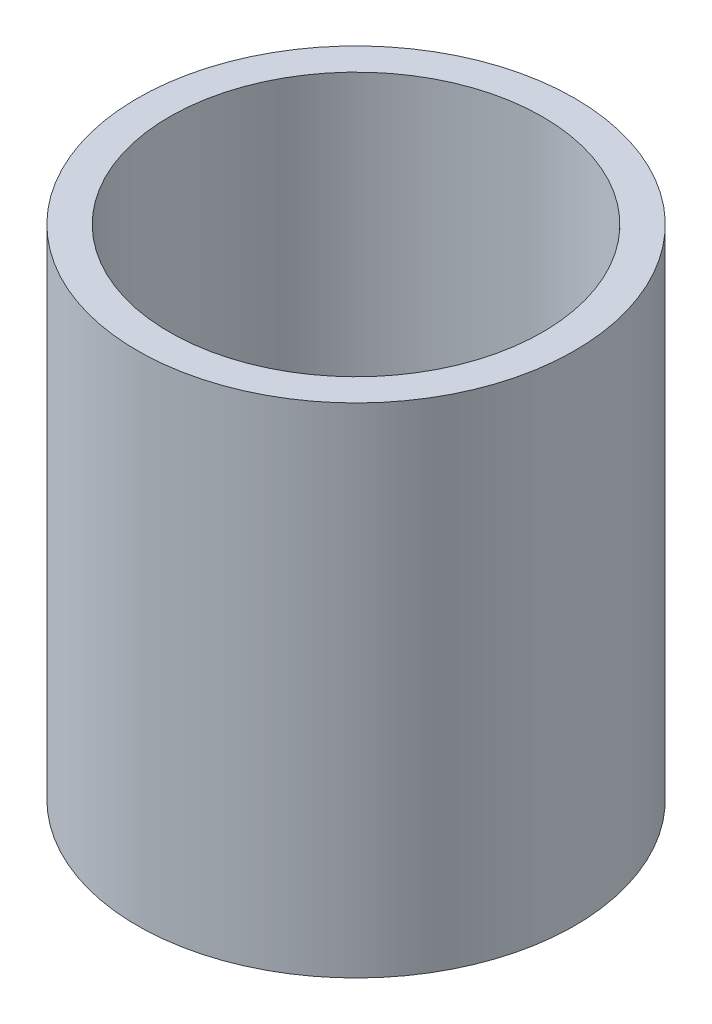
from build123d import *

# Parameters (mm, degrees)
SKETCH1_R           = 37.93506591
SKETCH1_R_2         = 32.368312022
BOSS_EXTRUDE1_DEPTH = 86.4


with BuildPart() as part:
    # Sketch1 → Boss-Extrude1 (new body)
    with BuildSketch(Plane(origin=(0, 0, 0), x_dir=(1, 0, 0), z_dir=(0, 1, 0))):
        Circle(SKETCH1_R)
        Circle(SKETCH1_R_2, mode=Mode.SUBTRACT)
    extrude(amount=BOSS_EXTRUDE1_DEPTH)


solid = part.part
